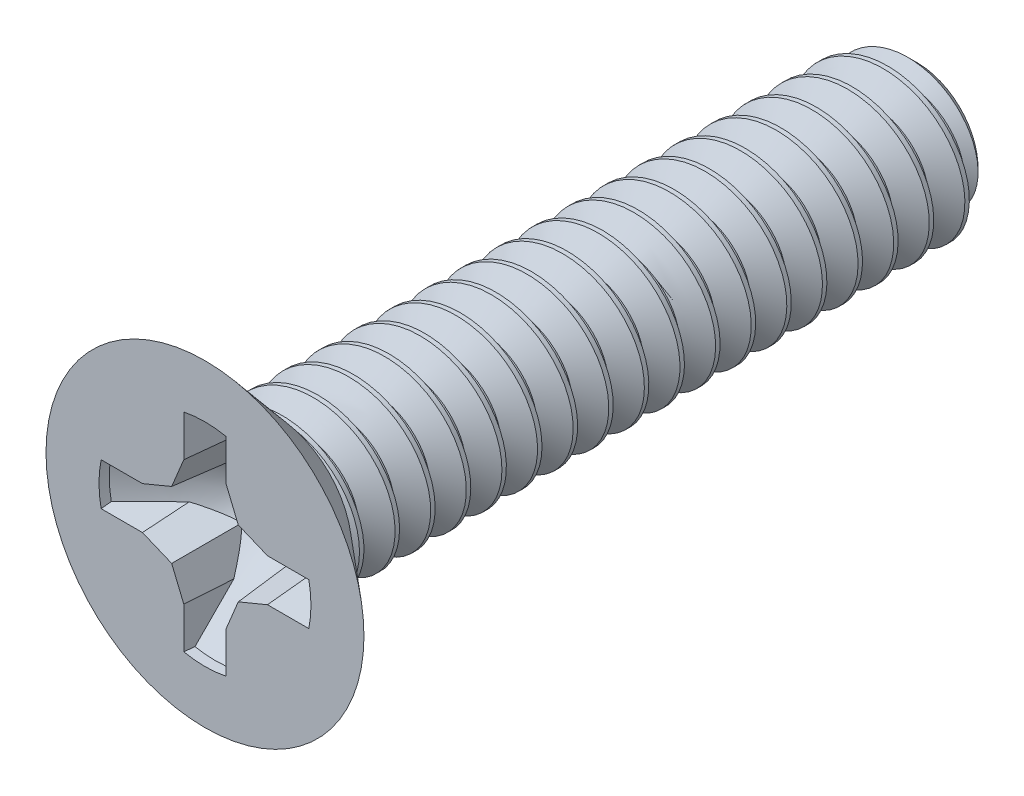
from build123d import *

# Parameters (mm, degrees)
CUT_EXTRUDE1_REACH  = 18.647
CIRPATTERN1_COUNT   = 4
DRAFT2_ANGLE        = 5
BOSS_EXTRUDE3_REACH = 18.647
CUT_SWEEP1_PITCH    = 0.79375
CUT_SWEEP1_TO       = 14.351
CUT_EXTRUDE2_REACH  = 18.647
CIRPATTERN2_COUNT   = 4
DRAFT3_ANGLE        = 5


with BuildPart() as part:
    # Sketch3 → Revolve1 (revolve)
    with BuildSketch(Plane(origin=(0, 0, 0), x_dir=(0, 0, -1), z_dir=(1, 0, 0)), mode=Mode.PRIVATE) as revolve1_sk:
        Polygon((-7.9375, 0), (-7.9375, 3.5433), (-6.4135, 1.7526), (7.540625, 1.7526), (7.9375, 1.355725), (7.9375, 0), align=None)
    revolve(revolve1_sk.sketch.rotate(Axis((0, 0, -7.9375), (0, 0, 1)), 90), axis=Axis((0, 0, -7.9375), (0, 0, 1)))

    # Cut-Extrude1: up to this cone (the profile starts inside it)
    cut_extrude1_end = Plane(origin=(0, 0, 7.9375), z_dir=(0, 0, 1)).offset(-2.240104716) * Cone(1.175e-06, 28.222595171, 24.019228933, align=(Align.CENTER, Align.CENTER, Align.MIN), mode=Mode.PRIVATE)
    # Sketch4 → Cut-Extrude1 (cut, up to the surface)
    with BuildSketch(Plane.XY.offset(7.9375), mode=Mode.PRIVATE) as cut_extrude1_sk1:
        with BuildLine():
            Line((0.47244, 2.314473868), (0.47244, 1.393456934))
            Line((0.47244, 1.393456934), (0.742199614, 0.742199614))
            Line((0.742199614, 0.742199614), (1.393456934, 0.47244))
            Line((1.393456934, 0.47244), (2.314473868, 0.47244))
            ThreePointArc((2.314473868, 0.47244), (2.350238181, 0.23742227), (2.3622, 0))
            Line((2.3622, 0), (0, 0))
            Line((0, 0), (0, 2.3622))
            ThreePointArc((0, 2.3622), (0.23742227, 2.350238181), (0.47244, 2.314473868))
        make_face()
    cut_extrude1_tool1 = extrude(cut_extrude1_sk1.sketch, amount=-CUT_EXTRUDE1_REACH, mode=Mode.PRIVATE) & cut_extrude1_end
    cut_extrude1 = cut_extrude1_tool1.solids().sort_by_distance((0.234065, 2.317001, 7.9375))[0]
    add(cut_extrude1, mode=Mode.SUBTRACT)

    # CirPattern1: Cut-Extrude1 ×4 about axis
    cirpattern1_axis = Axis((0, 0, 0), (0, 0, 1))
    for i in range(1, CIRPATTERN1_COUNT):
        add(cut_extrude1.rotate(cirpattern1_axis, i * 360 / CIRPATTERN1_COUNT), mode=Mode.SUBTRACT)

    # Draft2
    draft2_faces = [part.faces().sort_by_distance(p)[0] for p in [
        (-0.47244, -1.758632485, 7.592807697),
        (0.47244, -1.758632485, 7.592807697),
        (0.614196174, -1.051227257, 7.340058377),
        (1.051227257, -0.614196174, 7.340058377),
        (1.758632485, -0.47244, 7.592807697),
        (1.758632485, 0.47244, 7.592807697),
        (1.051227257, 0.614196174, 7.340058377),
        (0.614196174, 1.051227257, 7.340058377),
        (0.47244, 1.758632485, 7.592807697),
        (-0.47244, 1.758632485, 7.592807697),
        (-0.614196174, 1.051227257, 7.340058377),
        (-1.051227257, 0.614196174, 7.340058377),
        (-1.758632485, 0.47244, 7.592807697),
        (-1.758632485, -0.47244, 7.592807697),
        (-1.051227257, -0.614196174, 7.340058377),
        (-0.614196174, -1.051227257, 7.340058377),
    ]]
    draft(draft2_faces, Plane.XY.offset(7.9375), DRAFT2_ANGLE)

    # Sketch11 → Boss-Extrude3 (add, up to next)
    with BuildSketch(Plane.XY.offset(7.9375), mode=Mode.PRIVATE) as boss_extrude3_sk1:
        with BuildLine():
            Line((1.393456934, -0.47244), (2.314473868, -0.47244))
            ThreePointArc((2.314473868, -0.47244), (2.3622, 0), (2.314473868, 0.47244))
            Line((2.314473868, 0.47244), (1.393456934, 0.47244))
            Line((1.393456934, 0.47244), (0.742199614, 0.742199614))
            Line((0.742199614, 0.742199614), (0.47244, 1.393456934))
            Line((0.47244, 1.393456934), (0.47244, 2.314473868))
            ThreePointArc((0.47244, 2.314473868), (0, 2.3622), (-0.47244, 2.314473868))
            Line((-0.47244, 2.314473868), (-0.47244, 1.393456934))
            Line((-0.47244, 1.393456934), (-0.742199614, 0.742199614))
            Line((-0.742199614, 0.742199614), (-1.393456934, 0.47244))
            Line((-1.393456934, 0.47244), (-2.314473868, 0.47244))
            ThreePointArc((-2.314473868, 0.47244), (-2.3622, 0), (-2.314473868, -0.47244))
            Line((-2.314473868, -0.47244), (-1.393456934, -0.47244))
            Line((-1.393456934, -0.47244), (-0.742199614, -0.742199614))
            Line((-0.742199614, -0.742199614), (-0.47244, -1.393456934))
            Line((-0.47244, -1.393456934), (-0.47244, -2.314473868))
            ThreePointArc((-0.47244, -2.314473868), (0, -2.3622), (0.47244, -2.314473868))
            Line((0.47244, -2.314473868), (0.47244, -1.393456934))
            Line((0.47244, -1.393456934), (0.742199614, -0.742199614))
            Line((0.742199614, -0.742199614), (1.393456934, -0.47244))
        make_face()
    boss_extrude3_tool1 = extrude(boss_extrude3_sk1.sketch, amount=-BOSS_EXTRUDE3_REACH, mode=Mode.PRIVATE) - part.part
    add(boss_extrude3_tool1.solids().sort_by_distance((0, 0, 7.9375))[0])


with BuildPart() as body_2:
    # Split1: the piece on the far side of the plane
    add(part.part)
    split(bisect_by=Plane.XY.offset(6.4135), keep=Keep.BOTTOM)

    # Cut-Sweep1: arcs per turn and ends read off the stored shape
    # Cut-Sweep1: the profile of Sketch6 screwed along a right-hand helix through 20 turns, 8 arcs to a turn; built about Z, then put on its axis
    cut_sweep1_z = Axis((0, 0, 0), (0, 0, 1))
    cut_sweep1_corners = [(1.237044252, 0, -0.29765625), (1.795562979, 0, 0.024804688), (1.795562979, 0, -0.719335937), (1.237044252, 0, -0.396875)]
    with BuildLine(mode=Mode.PRIVATE) as cut_sweep1_profile:
        Line(cut_sweep1_corners[0], cut_sweep1_corners[1])
        Line(cut_sweep1_corners[1], cut_sweep1_corners[2])
        Line(cut_sweep1_corners[2], cut_sweep1_corners[3])
        Line(cut_sweep1_corners[3], cut_sweep1_corners[0])
    cut_sweep1_cap = Face(cut_sweep1_profile.wire())
    cut_sweep1_turn_angles = [0, 22.5, 45, 67.5, 90, 112.5, 135, 157.5, 180, 202.5, 225, 247.5, 270, 292.5, 315, 337.5, 360]
    cut_sweep1_turn_weights = [1, 0.9238795325112867, 1, 0.9238795325112867, 1, 0.9238795325112867, 1, 0.9238795325112867, 1, 0.9238795325112867, 1, 0.9238795325112867, 1, 0.9238795325112867, 1, 0.9238795325112867, 1]
    cut_sweep1_turn_rails = [Edge.make_bspline([Vector(p[0], p[1], 0).rotate(cut_sweep1_z, cut_sweep1_turn_angles[k]) / cut_sweep1_turn_weights[k] + Vector(0, 0, p[2] + CUT_SWEEP1_PITCH * cut_sweep1_turn_angles[k] / 360) for k in range(17)], [0, 0, 0, 1, 1, 2, 2, 3, 3, 4, 4, 5, 5, 6, 6, 7, 7, 8, 8, 8], 2, cut_sweep1_turn_weights) for p in cut_sweep1_corners]
    cut_sweep1_turn_sides = [Face.make_surface_from_curves(cut_sweep1_turn_rails[p[0]], cut_sweep1_turn_rails[p[1]]) for p in [(0, 1), (1, 2), (2, 3), (3, 0)]]
    cut_sweep1 = Plane(origin=(0, 0, -7.9375), x_dir=(0, 1, 0), z_dir=(0, 0, 1)) * split(Solid(Shell([*[p.moved(Location((0, 0, CUT_SWEEP1_PITCH * i))) for i in range(20) for p in cut_sweep1_turn_sides], cut_sweep1_cap, cut_sweep1_cap.rotate(cut_sweep1_z, 7200).moved(Location((0, 0, CUT_SWEEP1_PITCH * 7200 / 360)))])), bisect_by=Plane.XY.offset(CUT_SWEEP1_TO), keep=Keep.BOTTOM, mode=Mode.PRIVATE)
    add(cut_sweep1, mode=Mode.SUBTRACT)


with BuildPart() as part_1:
    add(part.part)

    # Split1
    split(bisect_by=Plane.XY.offset(6.4135), keep=Keep.TOP)

    add(body_2.part)  # Boss-Extrude4 merges body 2
    # Boss-Extrude4: read off the stored shape, not the designer's step
    # Boss-Extrude4 outline → Boss-Extrude4 (revolve)
    with BuildSketch(Plane.XZ):
        Polygon((1.237039445, 6.4135), (1.237039445, 6.115840975), (1.7526, 6.4135), align=None)
    revolve(axis=Axis((0, 0, 0), (0, 0, 1)))

    # Cut-Extrude2: up to this cone (the profile starts inside it)
    cut_extrude2_end = Plane(origin=(0, 0, 7.9375), z_dir=(0, 0, 1)).offset(-2.240104716) * Cone(1.175e-06, 28.222595171, 24.019228933, align=(Align.CENTER, Align.CENTER, Align.MIN), mode=Mode.PRIVATE)
    # Sketch13 → Cut-Extrude2 (cut, up to the surface)
    with BuildSketch(Plane.XY.offset(7.9375), mode=Mode.PRIVATE) as cut_extrude2_sk1:
        with BuildLine():
            Line((0.47244, 2.314473868), (0.47244, 1.393456934))
            Line((0.47244, 1.393456934), (0.742199614, 0.742199614))
            Line((0.742199614, 0.742199614), (1.393456934, 0.47244))
            Line((1.393456934, 0.47244), (2.314473868, 0.47244))
            ThreePointArc((2.314473868, 0.47244), (2.350238181, 0.23742227), (2.3622, 0))
            Line((2.3622, 0), (0, 0))
            Line((0, 0), (0, 2.3622))
            ThreePointArc((0, 2.3622), (0.23742227, 2.350238181), (0.47244, 2.314473868))
        make_face()
    cut_extrude2_tool1 = extrude(cut_extrude2_sk1.sketch, amount=-CUT_EXTRUDE2_REACH, mode=Mode.PRIVATE) & cut_extrude2_end
    cut_extrude2 = cut_extrude2_tool1.solids().sort_by_distance((0.234065, 2.317001, 7.9375))[0]
    add(cut_extrude2, mode=Mode.SUBTRACT)

    # CirPattern2: Cut-Extrude2 ×4 about axis
    cirpattern2_axis = Axis((0, 0, 0), (0, 0, 1))
    for i in range(1, CIRPATTERN2_COUNT):
        add(cut_extrude2.rotate(cirpattern2_axis, i * 360 / CIRPATTERN2_COUNT), mode=Mode.SUBTRACT)

    # Draft3
    draft3_faces = [part_1.faces().sort_by_distance(p)[0] for p in [
        (0.47244, 1.758632485, 7.592807697),
        (0.614196174, 1.051227257, 7.340058377),
        (1.051227257, 0.614196174, 7.340058377),
        (1.758632485, 0.47244, 7.592807697),
        (1.758632485, -0.47244, 7.592807697),
        (1.051227257, -0.614196174, 7.340058377),
        (0.614196174, -1.051227257, 7.340058377),
        (0.47244, -1.758632485, 7.592807697),
        (-0.47244, -1.758632485, 7.592807697),
        (-0.614196174, -1.051227257, 7.340058377),
        (-1.051227257, -0.614196174, 7.340058377),
        (-1.758632485, -0.47244, 7.592807697),
        (-1.758632485, 0.47244, 7.592807697),
        (-0.47244, 1.758632485, 7.592807697),
        (-0.614196174, 1.051227257, 7.340058377),
        (-1.051227257, 0.614196174, 7.340058377),
    ]]
    draft(draft3_faces, Plane.XY.offset(7.9375), DRAFT3_ANGLE)


solid = part_1.part
